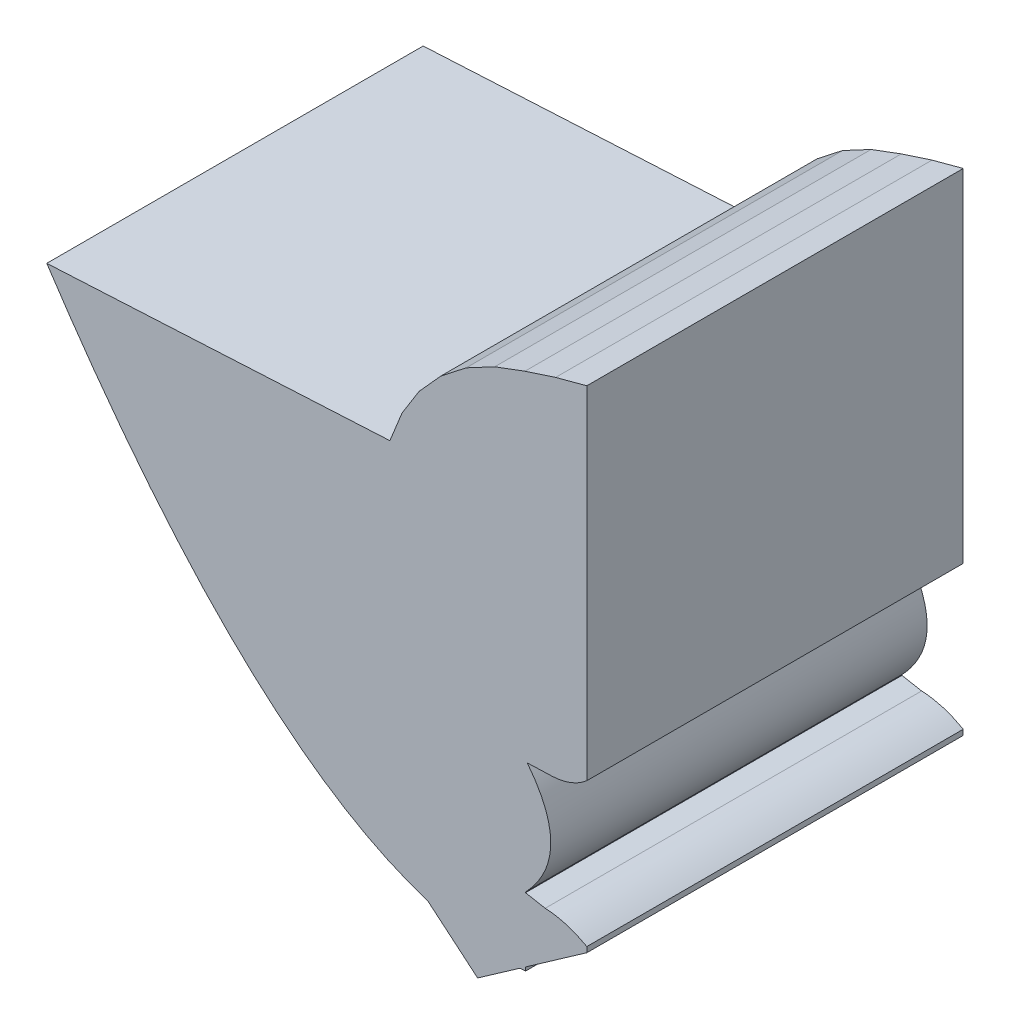
from build123d import *

# Parameters (mm, degrees)
CROQUIS_BASE_DEPTH              = 6.9937
LENTE_PPAL_1_REACH              = 29.176
LENTE_PPAL_1_DIRECTION_2_REACH  = 29.176
LENTE_PPAL_2_DEPTH              = 28.175928622
LENTE_PPAL_2_DEPTH_BACK         = 28.175928622
CROQUIS9_3_OUTSIDE_W            = 30.065
CROQUIS9_3_OUTSIDE_H            = 25.937
LENTE_FRONTAL_REACH             = 25.403
LENTE_FRONTAL_DIRECTION_2_REACH = 25.403
LENTE_TRASERA_REACH             = 28.281
LENTE_TRASERA_DIRECTION_2_REACH = 28.281


with BuildPart() as part:
    # Croquis1 → croquis base (new, symmetric)
    with BuildSketch(Plane.XY):
        with BuildLine():
            Line((-6.994875026, 10.477389992), (-8.981845695, 12.608155172))
            Line((-8.981845695, 12.608155172), (-23.035921146, 11.871612288))
            Line((-23.035921146, 11.871612288), (-23.035921146, 11.54013782))
            ThreePointArc((-23.035921146, 11.54013782), (-20.949684518, 9.582335705), (-18.945192114, 7.540918896))
            add(Edge.make_bspline(
                [(-18.945192114, 7.540918896), (-10.215008384, -3.697644103), (-2.846604825, -5.059081104)],
                knots=[0.497667241, 0.497667241, 0.497667241, 0.49955428, 0.49955428, 0.49955428], degree=2))
            add(Edge.make_bspline(
                [(-2.846604825, -5.059081104), (-2.498165198, -4.87297933), (-2.177330417, -4.684462446)],
                knots=[0.498812075, 0.498812075, 0.498812075, 0.498911556, 0.498911556, 0.498911556], degree=2))
            Line((-2.177330418, -4.684462446), (-2.177330418, 6.186438919))
            add(Edge.make_bspline(
                [(-2.177330418, 6.186438919), (-4.063319702, 8.141636997), (-6.994875026, 10.477389992)],
                knots=[0.50138293, 0.50138293, 0.50138293, 0.502013312, 0.502013312, 0.502013312], degree=2))
        make_face()
    extrude(amount=CROQUIS_BASE_DEPTH, both=True)

    # lente ppal 1: up to this face of the body (flat: up to its plane)
    lente_ppal_1_end = Plane(part.part.faces().sort_by_distance((-10.153546236, 5.159655324, 6.9937))[0])
    # Croquis9 → lente ppal 1 (add, up to the picked face)
    with BuildSketch(Plane.XY, mode=Mode.PRIVATE) as lente_ppal_1_sk1:
        with BuildLine():
            Line((-2.177330418, -4.388282022), (-2.177330418, -1.840420572))
            add(Edge.make_bspline(
                [(-2.177330418, 2.424232079), (-0.304369248, 0.128042884), (-2.177330418, -1.840420572)],
                knots=[0, 0, 0, 1, 1, 1], degree=2))
            Line((-2.177330418, 2.424232079), (-2.177330418, 6.082860828))
            Line((-2.177330418, 6.082860828), (-10.309820395, 10))
            Line((-10.309820395, 10), (-19.969359014, 9.493765032))
            add(Edge.make_bspline(
                [(-2.177330418, -4.388282022), (-10.4130765, -4.994158739), (-19.969359014, 9.493765032)],
                knots=[0, 0, 0, 1, 1, 1], degree=2))
        make_face()
    lente_ppal_1_tool1 = split(extrude(lente_ppal_1_sk1.sketch, amount=LENTE_PPAL_1_REACH, mode=Mode.PRIVATE), bisect_by=lente_ppal_1_end, keep=Keep.BOTH, mode=Mode.PRIVATE)
    add(lente_ppal_1_tool1.solids().sort_by(Axis((-9.106368, 3.599172, 0), (0, 0, 1)))[0])

    # lente ppal 1 direction 2: up to this face of the body (flat: up to its plane)
    lente_ppal_1_direction_2_end = Plane(part.part.faces().sort_by_distance((-10.153546236, 5.159655324, -6.9937))[0])
    # Croquis9 → lente ppal 1 direction 2 (add, up to the picked face)
    with BuildSketch(Plane.XY, mode=Mode.PRIVATE) as lente_ppal_1_direction_2_sk1:
        with BuildLine():
            Line((-2.177330418, -4.388282022), (-2.177330418, -1.840420572))
            add(Edge.make_bspline(
                [(-2.177330418, 2.424232079), (-0.304369248, 0.128042884), (-2.177330418, -1.840420572)],
                knots=[0, 0, 0, 1, 1, 1], degree=2))
            Line((-2.177330418, 2.424232079), (-2.177330418, 6.082860828))
            Line((-2.177330418, 6.082860828), (-10.309820395, 10))
            Line((-10.309820395, 10), (-19.969359014, 9.493765032))
            add(Edge.make_bspline(
                [(-2.177330418, -4.388282022), (-10.4130765, -4.994158739), (-19.969359014, 9.493765032)],
                knots=[0, 0, 0, 1, 1, 1], degree=2))
        make_face()
    lente_ppal_1_direction_2_tool1 = split(extrude(lente_ppal_1_direction_2_sk1.sketch, amount=-LENTE_PPAL_1_DIRECTION_2_REACH, mode=Mode.PRIVATE), bisect_by=lente_ppal_1_direction_2_end, keep=Keep.BOTH, mode=Mode.PRIVATE)
    add(lente_ppal_1_direction_2_tool1.solids().sort_by(Axis((-9.106368, 3.599172, 0), (0, 0, -1)))[0])

    # Croquis9<3> outside → lente ppal 2 (cut, two sides: drawn at the far end of the back side and taken through both)
    with BuildSketch(Plane.XY.offset(-LENTE_PPAL_2_DEPTH_BACK)):
        with Locations((-12.1385, 3.7745)):
            Rectangle(CROQUIS9_3_OUTSIDE_W, CROQUIS9_3_OUTSIDE_H)
        with BuildLine():
            Line((-2.177330418, -1.840420572), (-2.177330418, -4.388282022))
            add(Edge.make_bspline(
                [(-2.177330418, -4.388282022), (-10.4130765, -4.994158739), (-19.969359014, 9.493765032)],
                knots=[0, 0, 0, 1, 1, 1], degree=2))
            Line((-19.969359014, 9.493765032), (-10.309820395, 10))
            Line((-10.309820395, 10), (-2.177330418, 6.082860828))
            Line((-2.177330418, 6.082860828), (-2.177330418, 2.424232079))
            add(Edge.make_bspline(
                [(-2.177330418, 2.424232079), (-0.304369248, 0.128042884), (-2.177330418, -1.840420572)],
                knots=[0, 0, 0, 1, 1, 1], degree=2))
        make_face(mode=Mode.SUBTRACT)
    extrude(amount=LENTE_PPAL_2_DEPTH + LENTE_PPAL_2_DEPTH_BACK, mode=Mode.SUBTRACT)

    # lente frontal: up to this face of the body (flat: up to its plane)
    lente_frontal_end = Plane(part.part.faces().sort_by_distance((-9.106367081, 3.599171888, 6.9937))[0])
    # Croquis8 → lente frontal (add, up to the picked face)
    with BuildSketch(Plane.XY, mode=Mode.PRIVATE) as lente_frontal_sk1:
        with BuildLine():
            Line((0.1, 2.877673418), (0.1, 15.587903347))
            Line((0.1, 15.587903347), (-1.059110992, 15.277320493))
            Line((-1.059110992, 15.277320493), (-2.200378811, 14.9065001))
            Line((-2.200378811, 14.9065001), (-3.324385438, 14.486251242))
            Line((-3.324385438, 14.486251242), (-4.38392255, 13.922885367))
            Line((-4.38392255, 13.922885367), (-5.329535454, 13.184091597))
            Line((-5.329535454, 13.184091597), (-6.132492182, 12.292317806))
            Line((-6.132492182, 12.292317806), (-6.768395299, 11.274660091))
            Line((-6.768395299, 11.274660091), (-7.217923211, 10.162039465))
            Line((-7.217923211, 10.162039465), (-10.309820395, 10))
            Line((-10.309820395, 10), (-2.177330418, 2.342487007))
            Line((-2.177330418, 2.342487007), (-1.190501641, 2.376947827))
            add(Edge.make_bspline(
                [(-1.190501641, 2.376947827), (-0.463368169, 2.402339888), (0.1, 2.877673418)],
                knots=[0, 0, 0, 1, 1, 1], degree=2))
        make_face()
    lente_frontal_tool1 = split(extrude(lente_frontal_sk1.sketch, amount=LENTE_FRONTAL_REACH, mode=Mode.PRIVATE), bisect_by=lente_frontal_end, keep=Keep.BOTH, mode=Mode.PRIVATE)
    add(lente_frontal_tool1.solids().sort_by(Axis((-3.290182, 8.96302, 0), (0, 0, 1)))[0])

    # lente frontal direction 2: up to this face of the body (flat: up to its plane)
    lente_frontal_direction_2_end = Plane(part.part.faces().sort_by_distance((-9.106367081, 3.599171888, -6.9937))[0])
    # Croquis8 → lente frontal direction 2 (add, up to the picked face)
    with BuildSketch(Plane.XY, mode=Mode.PRIVATE) as lente_frontal_direction_2_sk1:
        with BuildLine():
            Line((0.1, 2.877673418), (0.1, 15.587903347))
            Line((0.1, 15.587903347), (-1.059110992, 15.277320493))
            Line((-1.059110992, 15.277320493), (-2.200378811, 14.9065001))
            Line((-2.200378811, 14.9065001), (-3.324385438, 14.486251242))
            Line((-3.324385438, 14.486251242), (-4.38392255, 13.922885367))
            Line((-4.38392255, 13.922885367), (-5.329535454, 13.184091597))
            Line((-5.329535454, 13.184091597), (-6.132492182, 12.292317806))
            Line((-6.132492182, 12.292317806), (-6.768395299, 11.274660091))
            Line((-6.768395299, 11.274660091), (-7.217923211, 10.162039465))
            Line((-7.217923211, 10.162039465), (-10.309820395, 10))
            Line((-10.309820395, 10), (-2.177330418, 2.342487007))
            Line((-2.177330418, 2.342487007), (-1.190501641, 2.376947827))
            add(Edge.make_bspline(
                [(-1.190501641, 2.376947827), (-0.463368169, 2.402339888), (0.1, 2.877673418)],
                knots=[0, 0, 0, 1, 1, 1], degree=2))
        make_face()
    lente_frontal_direction_2_tool1 = split(extrude(lente_frontal_direction_2_sk1.sketch, amount=-LENTE_FRONTAL_DIRECTION_2_REACH, mode=Mode.PRIVATE), bisect_by=lente_frontal_direction_2_end, keep=Keep.BOTH, mode=Mode.PRIVATE)
    add(lente_frontal_direction_2_tool1.solids().sort_by(Axis((-3.290182, 8.96302, 0), (0, 0, -1)))[0])

    # lente trasera: up to this face of the body (flat: up to its plane)
    lente_trasera_end = Plane(part.part.faces().sort_by_distance((-7.357064552, 5.305385386, 6.9937))[0])
    # Croquis11 → lente trasera (add, up to the picked face)
    with BuildSketch(Plane.XY, mode=Mode.PRIVATE) as lente_trasera_sk1:
        with BuildLine():
            Line((0.1, -2.458811066), (0.1, -2.658811066))
            Line((0.1, -2.658811066), (-3.957638313, -5.5))
            Line((-3.957638313, -5.5), (-10.029650265, -0.404977011))
            Line((-10.029650265, -0.404977011), (-1.447650757, -2.001370848))
            add(Edge.make_bspline(
                [(-1.447650757, -2.001370848), (-0.67030688, -2.028516294), (0.1, -2.458811066)],
                knots=[0, 0, 0, 1, 1, 1], degree=2))
        make_face()
    lente_trasera_tool1 = split(extrude(lente_trasera_sk1.sketch, amount=LENTE_TRASERA_REACH, mode=Mode.PRIVATE), bisect_by=lente_trasera_end, keep=Keep.BOTH, mode=Mode.PRIVATE)
    add(lente_trasera_tool1.solids().sort_by(Axis((-4.514125, -2.758798, 0), (0, 0, 1)))[0])

    # lente trasera direction 2: up to this face of the body (flat: up to its plane)
    lente_trasera_direction_2_end = Plane(part.part.faces().sort_by_distance((-7.357064552, 5.305385386, -6.9937))[0])
    # Croquis11 → lente trasera direction 2 (add, up to the picked face)
    with BuildSketch(Plane.XY, mode=Mode.PRIVATE) as lente_trasera_direction_2_sk1:
        with BuildLine():
            Line((0.1, -2.458811066), (0.1, -2.658811066))
            Line((0.1, -2.658811066), (-3.957638313, -5.5))
            Line((-3.957638313, -5.5), (-10.029650265, -0.404977011))
            Line((-10.029650265, -0.404977011), (-1.447650757, -2.001370848))
            add(Edge.make_bspline(
                [(-1.447650757, -2.001370848), (-0.67030688, -2.028516294), (0.1, -2.458811066)],
                knots=[0, 0, 0, 1, 1, 1], degree=2))
        make_face()
    lente_trasera_direction_2_tool1 = split(extrude(lente_trasera_direction_2_sk1.sketch, amount=-LENTE_TRASERA_DIRECTION_2_REACH, mode=Mode.PRIVATE), bisect_by=lente_trasera_direction_2_end, keep=Keep.BOTH, mode=Mode.PRIVATE)
    add(lente_trasera_direction_2_tool1.solids().sort_by(Axis((-4.514125, -2.758798, 0), (0, 0, -1)))[0])


solid = part.part
